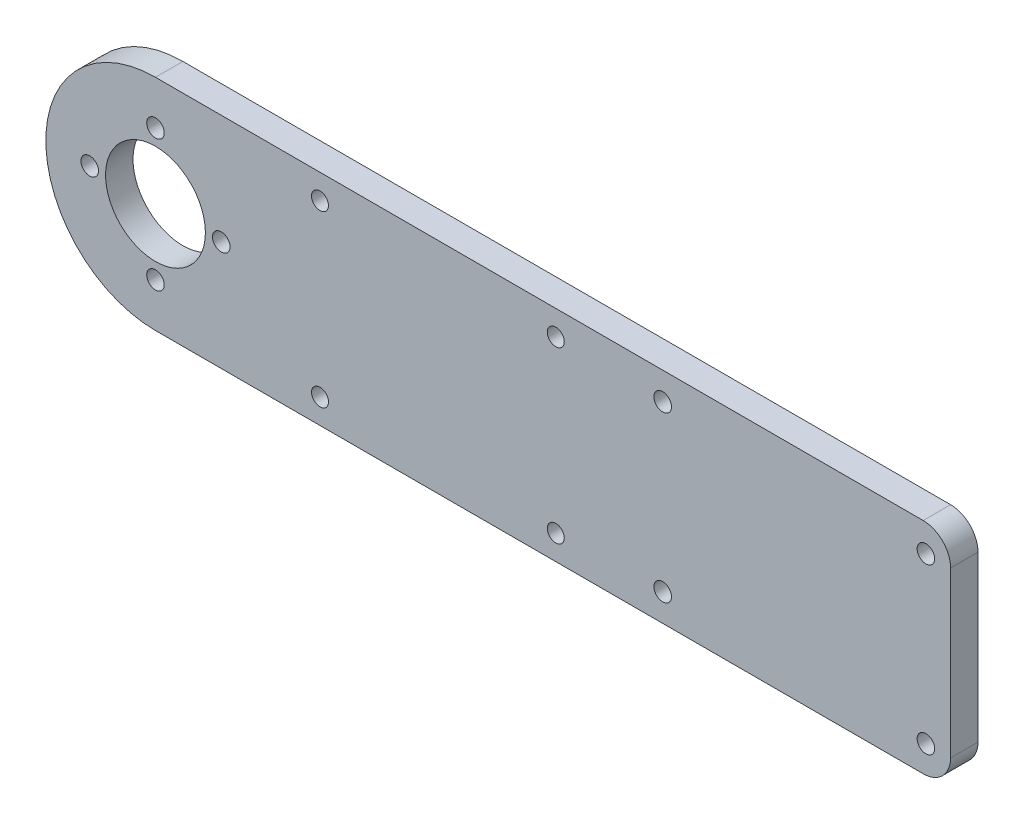
from build123d import *

# Parameters (mm, degrees)
SKETCH2_R           = 9.1
BOSS_EXTRUDE1_DEPTH = 2.5
FILLET1_R           = 5
SKETCH3_R           = 1.55
SKETCH3_R_2         = 1.6
CUT_EXTRUDE1_DEPTH  = 147.458185159


with BuildPart() as part:
    # Sketch2 → Boss-Extrude1 (new, symmetric)
    with BuildSketch(Plane.XY):
        with BuildLine():
            Line((145, 20), (0, 20))
            ThreePointArc((0, 20), (-20, 0), (0, -20))
            Line((0, -20), (145, -20))
            Line((145, -20), (145, 20))
        make_face()
        Circle(SKETCH2_R, mode=Mode.SUBTRACT)
    extrude(amount=BOSS_EXTRUDE1_DEPTH, both=True)

    # Fillet1
    fillet1_edges = [part.edges().sort_by_distance(p)[0] for p in [
        (145, -20, 0),
        (145, 20, 0),
    ]]
    fillet(fillet1_edges, radius=FILLET1_R)

    # Sketch3 → Cut-Extrude1 (cut, through all)
    with BuildSketch(Plane(origin=(0, 0, -2.5), x_dir=(-1, 0, 0), z_dir=(0, 0, -1))):
        with Locations((-30, 15.5)):
            Circle(SKETCH3_R)
        with Locations((-140.5, 15)):
            Circle(SKETCH3_R_2)
        with Locations((0, 12)):
            Circle(SKETCH3_R_2)
        with Locations((-12, 0)):
            Circle(SKETCH3_R_2)
        with Locations((12, 0)):
            Circle(SKETCH3_R_2)
        with Locations((0, -12)):
            Circle(SKETCH3_R_2)
        with Locations((-30, -15.5)):
            Circle(SKETCH3_R)
        with Locations((-73, -15.5)):
            Circle(SKETCH3_R)
        with Locations((-73, 15.5)):
            Circle(SKETCH3_R)
        with Locations((-140.5, -15)):
            Circle(SKETCH3_R_2)
        with Locations((-92.5, -15)):
            Circle(SKETCH3_R_2)
        with Locations((-92.5, 15)):
            Circle(SKETCH3_R_2)
    extrude(amount=-CUT_EXTRUDE1_DEPTH, mode=Mode.SUBTRACT)


solid = part.part
